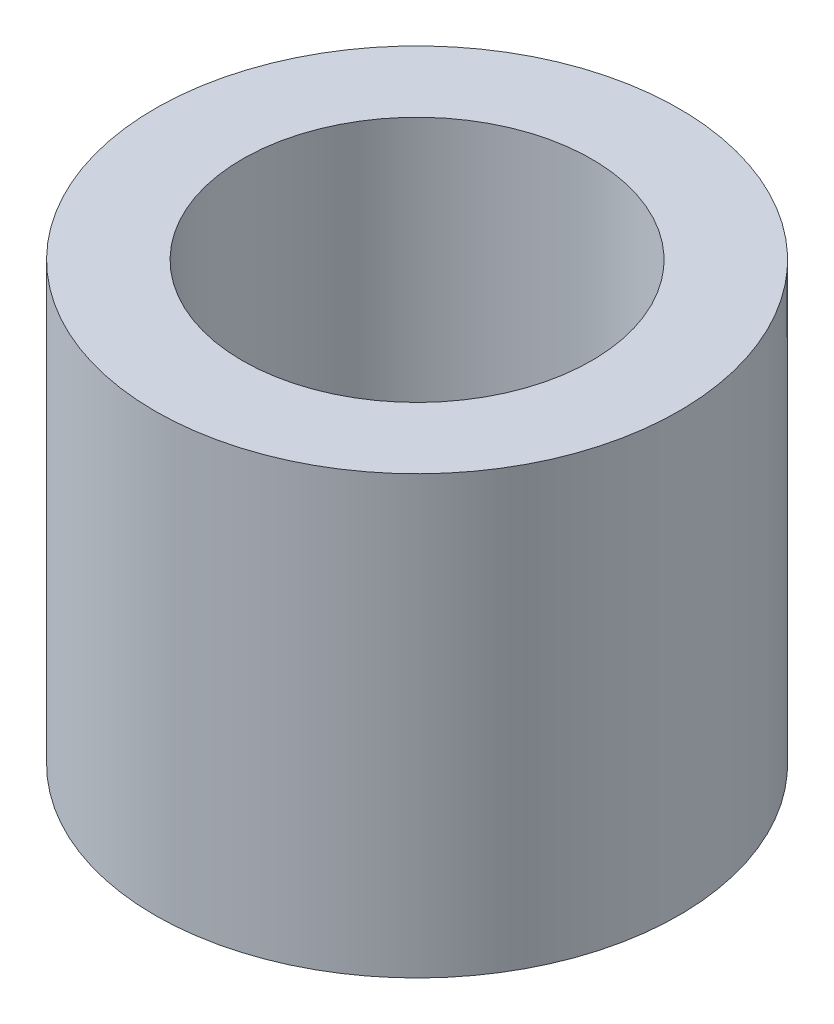
from build123d import *

# Parameters (mm, degrees)
SKETCH_1_R      = 1.5
SKETCH_1_R_2    = 1
EXTRUDE_1_DEPTH = 2.5


with BuildPart() as part:
    # Эскиз1 → Бобышка-Вытянуть1 (new body)
    with BuildSketch(Plane(origin=(0, 0, 0), x_dir=(1, 0, 0), z_dir=(0, 1, 0))):
        Circle(SKETCH_1_R)
        Circle(SKETCH_1_R_2, mode=Mode.SUBTRACT)
    extrude(amount=EXTRUDE_1_DEPTH)


solid = part.part
